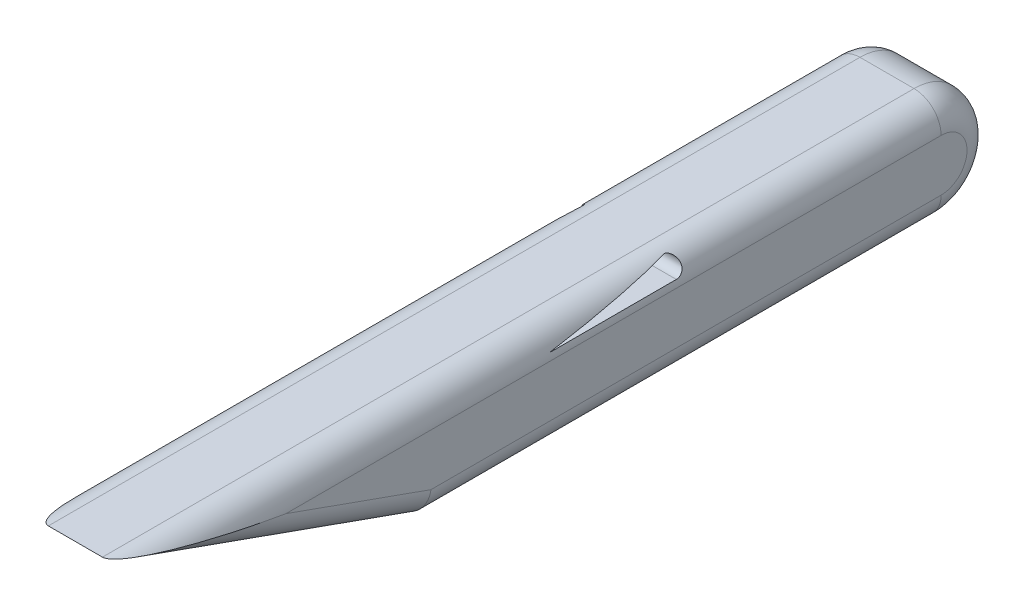
from build123d import *

# Parameters (mm, degrees)
BOSS_EXTRUDE1_DEPTH = 100
FILLET1_R           = 50
CUT_EXTRUDE1_DEPTH  = 300
SKETCH3_W           = 100
SKETCH3_H           = 1500
CUT_EXTRUDE2_DEPTH  = 146


with BuildPart() as part:
    # Sketch1 → Boss-Extrude1 (new, symmetric)
    with BuildSketch(Plane(origin=(0, 0, 0), x_dir=(0, 0, -1), z_dir=(1, 0, 0))):
        with BuildLine():
            Line((-537.016574586, 60.497237569), (11.602209945, -135.082872928))
            Line((11.602209945, -135.082872928), (962.983425414, -135.082872928))
            ThreePointArc((962.983425414, -135.082872928), (1060.773480663, -37.29281768), (962.983425414, 60.497237569))
            Line((962.983425414, 60.497237569), (-537.016574586, 60.497237569))
        make_face()
    extrude(amount=BOSS_EXTRUDE1_DEPTH, both=True)

    # Fillet1
    fillet1_edges = [part.edges().sort_by_distance(p)[0] for p in [
        (-100, -135.082872928, -487.29281768),
        (-100, -37.29281768, -1060.773480663),
        (100, 60.497237569, -212.983425414),
        (100, -37.29281768, -1060.773480663),
        (100, -37.29281768, 262.70718232),
        (-100, -37.29281768, 262.70718232),
        (-100, 60.497237569, -212.983425414),
        (100, -135.082872928, -487.29281768),
    ]]
    fillet(fillet1_edges, radius=FILLET1_R)

    # Sketch2 → Cut-Extrude1 (cut)
    with BuildSketch(Plane.ZY.offset(100)):
        with BuildLine():
            Line((-240.278412459, 23.075070398), (-475.216763111, 23.075070398))
            ThreePointArc((-475.216763111, 23.075070398), (-490.247556178, 39.100328004), (-473.293494818, 53.075070398))
            Line((-473.293494818, 53.075070398), (-240.278412459, 23.075070398))
        make_face()
    extrude(amount=-CUT_EXTRUDE1_DEPTH, mode=Mode.SUBTRACT)

    # Sketch3 → Cut-Extrude2 (cut)
    with BuildSketch(Plane.XZ.offset(135.082872928)):
        with Locations((0, -212.983425414)):
            Rectangle(SKETCH3_W, SKETCH3_H)
    extrude(amount=-CUT_EXTRUDE2_DEPTH, mode=Mode.SUBTRACT)


solid = part.part
